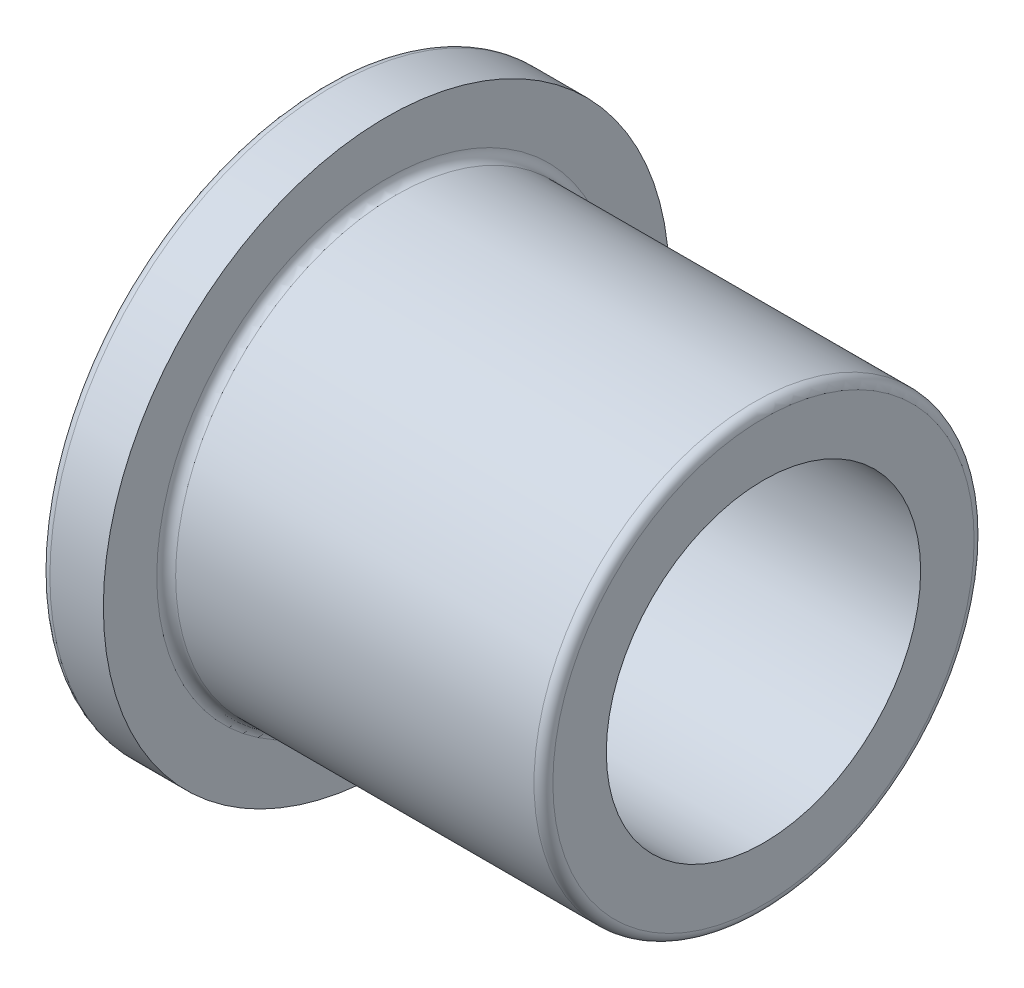
from build123d import *
from build123d.topology import SkipClean

# Parameters (mm, degrees)
SKETCH1_R           = 7
SKETCH1_R_2         = 5
BOSS_EXTRUDE1_DEPTH = 12
SKETCH2_R           = 9
SKETCH2_R_2         = 5
BOSS_EXTRUDE2_DEPTH = 2
FILLET1_R           = 0.3


with BuildPart() as part:
    # Sketch1 → Boss-Extrude1 (new body)
    with BuildSketch(Plane(origin=(0, 0, 0), x_dir=(0, 0, -1), z_dir=(1, 0, 0))):
        Circle(SKETCH1_R)
        Circle(SKETCH1_R_2, mode=Mode.SUBTRACT)
    extrude(amount=-BOSS_EXTRUDE1_DEPTH)

    # Sketch2 → Boss-Extrude2 (add)
    with SkipClean():  # the faces are left unmerged after this step: merging them gives an invalid solid
        with BuildSketch(Plane.ZY.offset(12)):
            Circle(SKETCH2_R)
            Circle(SKETCH2_R_2, mode=Mode.SUBTRACT)
        extrude(amount=BOSS_EXTRUDE2_DEPTH)
    add(part.part.scale(1), mode=Mode.REPLACE)  # the faces are merged on a copy

    # Fillet1
    fillet1_edges = [part.edges().sort_by_distance(p)[0] for p in [
        (-14, 0, -9),
        (0, 0, 7),
        (-12, 0, 7),
    ]]
    fillet(fillet1_edges, radius=FILLET1_R)


solid = part.part
